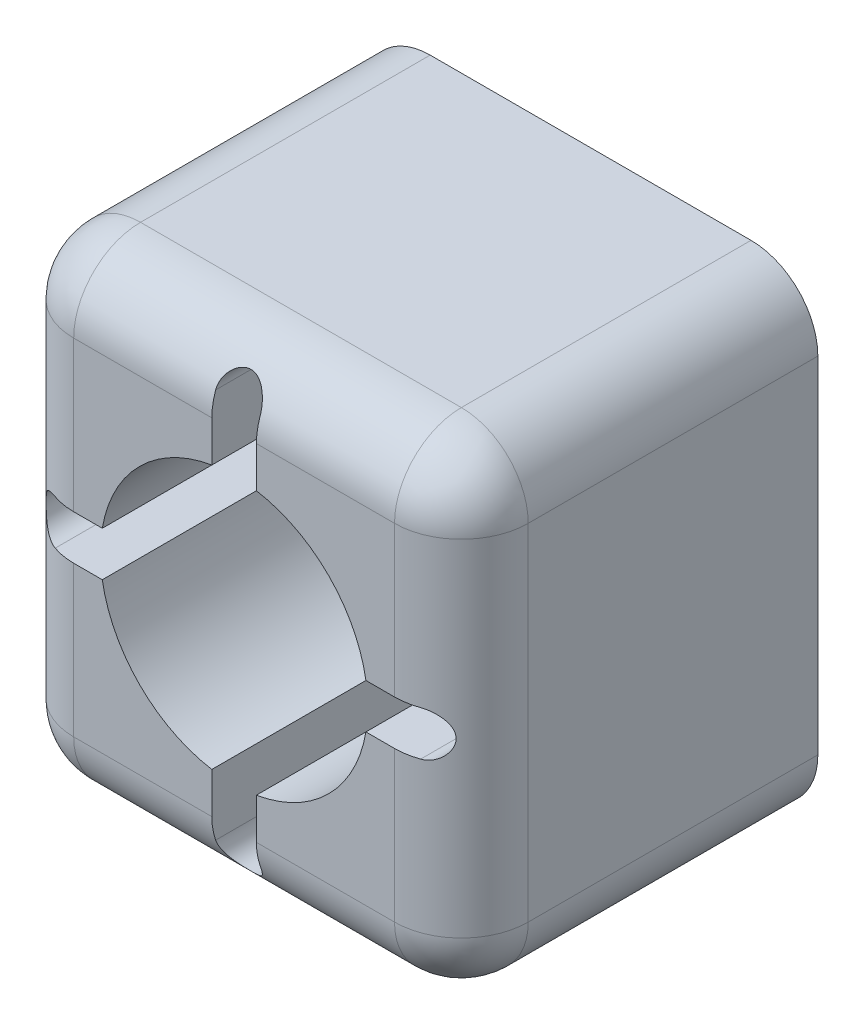
from build123d import *

# Parameters (mm, degrees)
SKETCH1_W       = 20.4
SKETCH1_H       = 21.5
EXTRUDE1_DEPTH  = 16
EXTRUDE10_DEPTH = 10
FILLET8_R       = 3


with BuildPart() as part:
    # Sketch1 → Extrude1 (new body)
    with BuildSketch(Plane.XY):
        with Locations((10.2, 10.75)):
            Rectangle(SKETCH1_W, SKETCH1_H)
    extrude(amount=-EXTRUDE1_DEPTH)

    # Sketch11 → Extrude10 (cut)
    with BuildSketch(Plane.XY):
        with BuildLine():
            Line((2, 11.75), (4.283920217, 11.75))
            ThreePointArc((4.283920217, 11.75), (5.957359313, 14.992640687), (9.2, 16.666079783))
            Line((9.2, 16.666079783), (9.2, 19.5))
            ThreePointArc((9.2, 19.5), (10.2, 20.5), (11.2, 19.5))
            Line((11.2, 19.5), (11.2, 16.666079783))
            ThreePointArc((11.2, 16.666079783), (14.442640687, 14.992640687), (16.116079783, 11.75))
            Line((16.116079783, 11.75), (18.4, 11.75))
            ThreePointArc((18.4, 11.75), (19.4, 10.75), (18.4, 9.75))
            Line((18.4, 9.75), (16.116079783, 9.75))
            ThreePointArc((16.116079783, 9.75), (14.442640687, 6.507359313), (11.2, 4.833920217))
            Line((11.2, 4.833920217), (11.2, 2))
            ThreePointArc((11.2, 2), (10.2, 1), (9.2, 2))
            Line((9.2, 2), (9.2, 4.833920217))
            ThreePointArc((9.2, 4.833920217), (5.957359313, 6.507359313), (4.283920217, 9.75))
            Line((4.283920217, 9.75), (2, 9.75))
            ThreePointArc((2, 9.75), (1, 10.75), (2, 11.75))
        make_face()
    extrude(amount=-EXTRUDE10_DEPTH, mode=Mode.SUBTRACT)

    # Fillet8
    # the kernel refuses this fillet: 3 mm, written as the material it takes off along each edge
    with BuildSketch(Plane(origin=(17.4, 3, -3), x_dir=(1, 0, 0), z_dir=(0, -1, 0))) as fillet8_piece_1_section:
        Polygon((0, 0), (FILLET8_R, 0), (FILLET8_R, FILLET8_R), (0, FILLET8_R), align=None)
    fillet8_piece_1 = extrude(amount=FILLET8_R, mode=Mode.PRIVATE)
    fillet8_piece_1 = fillet8_piece_1 - Plane(origin=(17.4, 3, -3), x_dir=(-0.7071067811865475, 0, -0.7071067811865475), z_dir=(0, -1, 0)) * Sphere(FILLET8_R, mode=Mode.PRIVATE)
    add(fillet8_piece_1, mode=Mode.SUBTRACT)
    with BuildSketch(Plane(origin=(17.4, 18.5, -3), x_dir=(0, 0, 1), z_dir=(1, 0, 0))) as fillet8_piece_2_section:
        Polygon((0, 0), (FILLET8_R, 0), (FILLET8_R, -FILLET8_R), (0, -FILLET8_R), align=None)
    fillet8_piece_2 = extrude(amount=FILLET8_R, mode=Mode.PRIVATE)
    fillet8_piece_2 = fillet8_piece_2 - Plane(origin=(17.4, 18.5, -3), x_dir=(0, -0.7071067811865475, -0.7071067811865475), z_dir=(1, 0, 0)) * Sphere(FILLET8_R, mode=Mode.PRIVATE)
    add(fillet8_piece_2, mode=Mode.SUBTRACT)
    with BuildSketch(Plane(origin=(3, 3, -3), x_dir=(-1, 0, 0), z_dir=(0, -1, 0))) as fillet8_piece_3_section:
        Polygon((0, 0), (FILLET8_R, 0), (FILLET8_R, -FILLET8_R), (0, -FILLET8_R), align=None)
    fillet8_piece_3 = extrude(amount=FILLET8_R, mode=Mode.PRIVATE)
    fillet8_piece_3 = fillet8_piece_3 - Plane(origin=(3, 3, -3), x_dir=(0.7071067811865475, 0, -0.7071067811865475), z_dir=(0, -1, 0)) * Sphere(FILLET8_R, mode=Mode.PRIVATE)
    add(fillet8_piece_3, mode=Mode.SUBTRACT)
    with BuildSketch(Plane(origin=(3, 18.5, -3), x_dir=(0, 0, 1), z_dir=(-1, 0, 0))) as fillet8_piece_4_section:
        Polygon((0, 0), (FILLET8_R, 0), (FILLET8_R, FILLET8_R), (0, FILLET8_R), align=None)
    fillet8_piece_4 = extrude(amount=FILLET8_R, mode=Mode.PRIVATE)
    fillet8_piece_4 = fillet8_piece_4 - Plane(origin=(3, 18.5, -3), x_dir=(0, -0.7071067811865475, -0.7071067811865475), z_dir=(-1, 0, 0)) * Sphere(FILLET8_R, mode=Mode.PRIVATE)
    add(fillet8_piece_4, mode=Mode.SUBTRACT)
    with BuildSketch(Plane(origin=(20.4, 3, 0), x_dir=(0, 0, -1), z_dir=(0, 1, 0)), Plane(origin=(0, 18.5, 0), x_dir=(0, 0, -1), z_dir=(0, -1, 0))) as fillet8_piece_5:
        with BuildLine():
            CenterArc((FILLET8_R, FILLET8_R), FILLET8_R, 180, 90)
            Line((0, FILLET8_R), (0, 0))
            Line((0, 0), (FILLET8_R, 0))
        make_face()
    extrude(amount=15.5, mode=Mode.SUBTRACT)
    with BuildSketch(Plane(origin=(3, 0, 0), x_dir=(0, 0, -1), z_dir=(1, 0, 0))) as fillet8_piece_6:
        with BuildLine():
            CenterArc((FILLET8_R, FILLET8_R), FILLET8_R, 180, 90)
            Line((0, FILLET8_R), (0, 0))
            Line((0, 0), (FILLET8_R, 0))
        make_face()
    extrude(amount=14.4, mode=Mode.SUBTRACT)
    with BuildSketch(Plane(origin=(17.4, 21.5, 0), x_dir=(0, -1, 0), z_dir=(-1, 0, 0))) as fillet8_piece_7:
        with BuildLine():
            CenterArc((FILLET8_R, -FILLET8_R), FILLET8_R, 90, 90)
            Line((0, -FILLET8_R), (0, 0))
            Line((0, 0), (FILLET8_R, 0))
        make_face()
    extrude(amount=14.4, mode=Mode.SUBTRACT)
    with BuildSketch(Plane(origin=(20.4, 0, -3), x_dir=(-1, 0, 0), z_dir=(0, 0, -1)), Plane(origin=(20.4, 21.5, -3), x_dir=(0, -1, 0), z_dir=(0, 0, -1))) as fillet8_piece_8:
        with BuildLine():
            CenterArc((FILLET8_R, FILLET8_R), FILLET8_R, 180, 90)
            Line((0, FILLET8_R), (0, 0))
            Line((0, 0), (FILLET8_R, 0))
        make_face()
    extrude(amount=20.5, mode=Mode.SUBTRACT)
    with BuildSketch(Plane(origin=(0, 21.5, -3), x_dir=(0, -1, 0), z_dir=(0, 0, -1)), Plane(origin=(0, 0, -3), x_dir=(1, 0, 0), z_dir=(0, 0, -1))) as fillet8_piece_9:
        with BuildLine():
            CenterArc((FILLET8_R, -FILLET8_R), FILLET8_R, 90, 90)
            Line((0, -FILLET8_R), (0, 0))
            Line((0, 0), (FILLET8_R, 0))
        make_face()
    extrude(amount=20.5, mode=Mode.SUBTRACT)


solid = part.part
